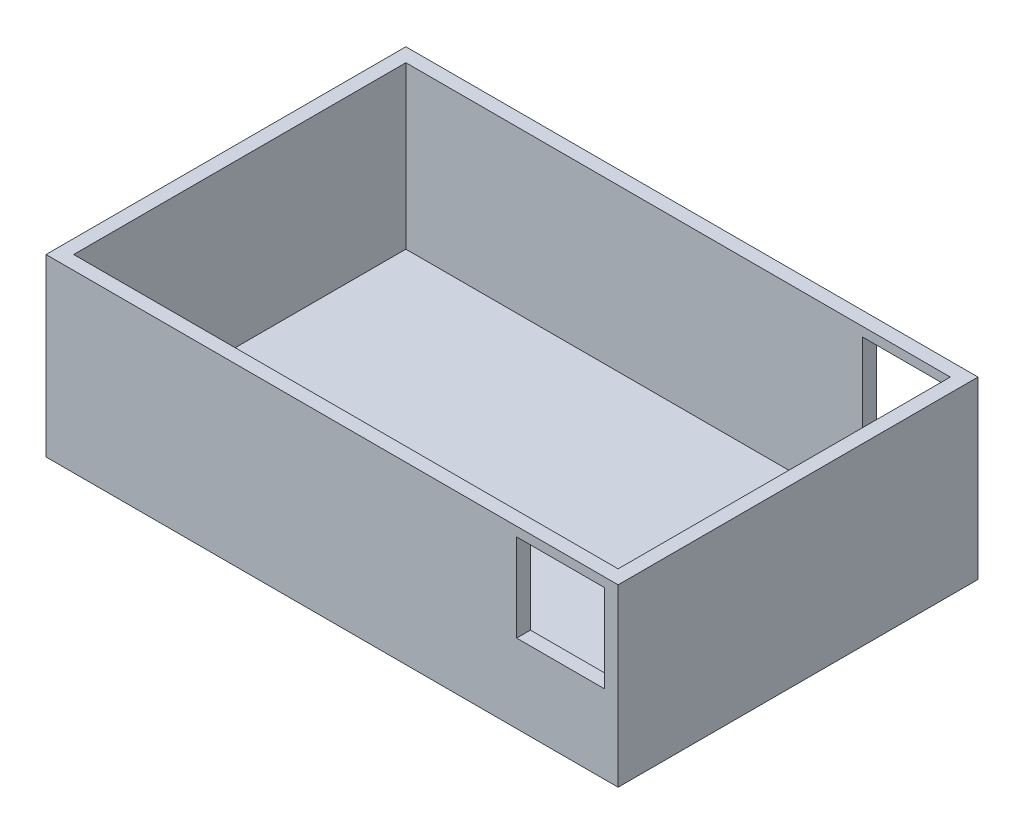
from build123d import *

# Parameters (mm, degrees)
SKETCH1_W           = 787.4
SKETCH1_H           = 495.3
BOSS_EXTRUDE1_DEPTH = 241.3
SHELL1_T            = -19.05
SKETCH2_W           = 120.65
SKETCH2_H           = 120.65
CUT_EXTRUDE1_DEPTH  = 962.01328815


with BuildPart() as part:
    # Sketch1 → Boss-Extrude1 (new body)
    with BuildSketch(Plane(origin=(0, 0, 0), x_dir=(1, 0, 0), z_dir=(0, 1, 0))):
        with Locations((393.7, 247.65)):
            Rectangle(SKETCH1_W, SKETCH1_H)
    extrude(amount=BOSS_EXTRUDE1_DEPTH)

    # Shell1
    shell1_openings = [part.faces().sort_by_distance(p)[0] for p in [
        (393.7, 241.3, -247.65),
    ]]
    offset(amount=SHELL1_T, openings=shell1_openings, kind=Kind.INTERSECTION)

    # Sketch2 → Cut-Extrude1 (cut, through all)
    with BuildSketch(Plane.XY):
        with Locations((708.025, 168.275)):
            Rectangle(SKETCH2_W, SKETCH2_H)
    extrude(amount=-CUT_EXTRUDE1_DEPTH, mode=Mode.SUBTRACT)


solid = part.part
